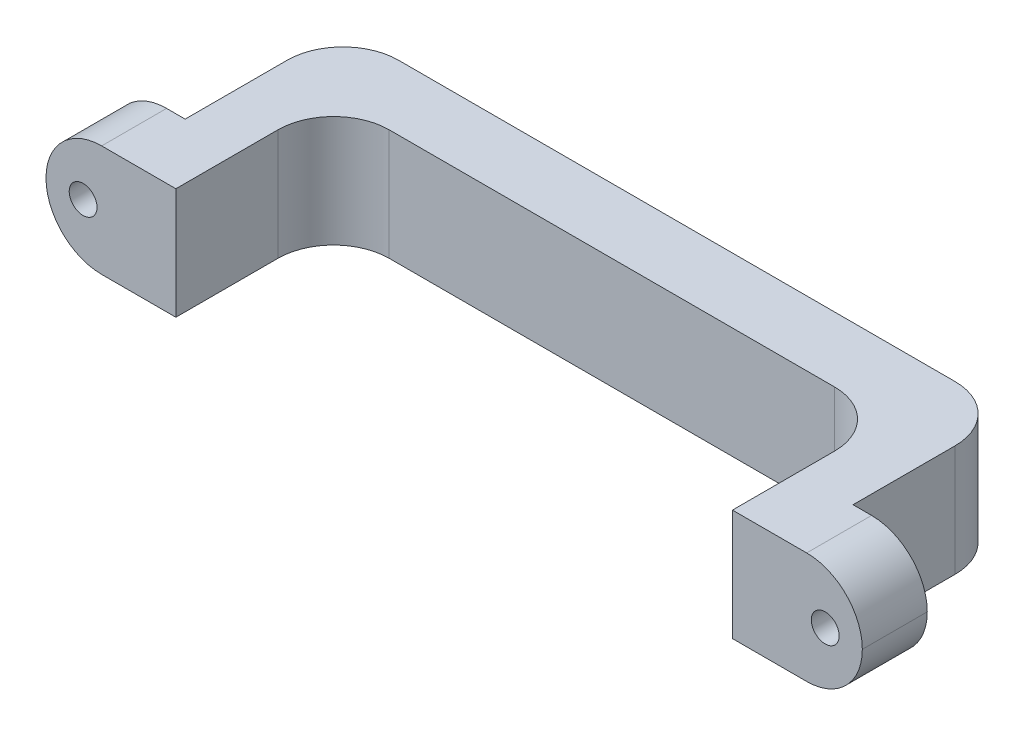
from build123d import *

# Parameters (mm, degrees)
EXTRUDE_2_DEPTH     = 12
SKETCH_6_R          = 1.5
CUT_EXTRUDE_2_DEPTH = 12
FILLET_2_R          = 6


with BuildPart() as part:
    # 草图3 → 凸台-拉伸2 (new body)
    with BuildSketch(Plane(origin=(0, 0, 0), x_dir=(1, 0, 0), z_dir=(0, 1, 0))):
        Polygon((0, 0), (14, 0), (14, 17), (74, 17), (74, 0), (88, 0), (88, 7), (80, 7), (80, 24), (8, 24), (8, 7), (0, 7), align=None)
    extrude(amount=EXTRUDE_2_DEPTH)

    # 草图6 → 切除-拉伸2 (cut)
    with BuildSketch(Plane(origin=(0, 0, -7), x_dir=(-1, 0, 0), z_dir=(0, 0, -1))):
        with Locations((-4, 6)):
            Circle(SKETCH_6_R)
        with Locations((-84, 6)):
            Circle(SKETCH_6_R)
    extrude(amount=-CUT_EXTRUDE_2_DEPTH, mode=Mode.SUBTRACT)

    # 圆角2
    fillet_2_edges = [part.edges().sort_by_distance(p)[0] for p in [
        (14, 6, -17),
        (8, 6, -24),
        (80, 6, -24),
        (74, 6, -17),
        (0, 12, -3.5),
        (0, 0, -3.5),
        (88, 12, -3.5),
        (88, 0, -3.5),
    ]]
    fillet(fillet_2_edges, radius=FILLET_2_R - 0.0001)  # a hair under: the kernel refuses the full size


solid = part.part
